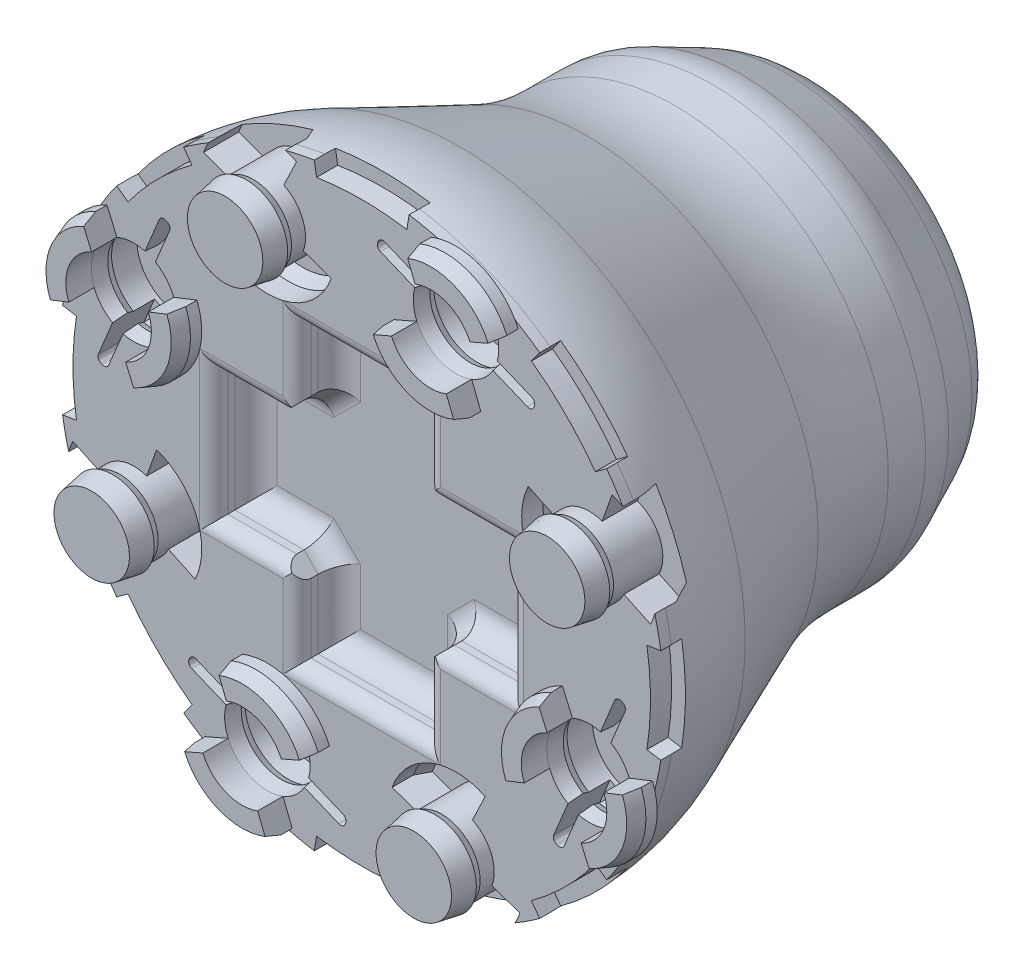
from build123d import *
from OCP.BRepFilletAPI import BRepFilletAPI_MakeChamfer
from build123d.topology import SkipClean

# Parameters (mm, degrees)
SKETCH1_R                    = 21.5
EXTRUDE1_DEPTH               = 4
CUT_EXTRUDE1_DEPTH           = 3
SKETCH3_R                    = 3.035
CUT_EXTRUDE2_DEPTH           = 1
CUT_EXTRUDE2_DRAFT           = -10
CUT_EXTRUDE2_PROFILE_2_DEPTH = 1
CUT_EXTRUDE2_PROFILE_2_DRAFT = -10
CUT_EXTRUDE2_PROFILE_3_DEPTH = 1
CUT_EXTRUDE2_PROFILE_3_DRAFT = -10
CUT_EXTRUDE2_PROFILE_4_DEPTH = 1
CUT_EXTRUDE2_PROFILE_4_DRAFT = -10
SKETCH4_R                    = 2.858673019
CUT_EXTRUDE4_DEPTH           = 0.5
CUT_EXTRUDE4_DRAFT           = 25
CUT_EXTRUDE4_PROFILE_2_DEPTH = 0.5
CUT_EXTRUDE4_PROFILE_2_DRAFT = 25
CUT_EXTRUDE4_PROFILE_3_DEPTH = 0.5
CUT_EXTRUDE4_PROFILE_3_DRAFT = 25
CUT_EXTRUDE4_PROFILE_4_DEPTH = 0.5
CUT_EXTRUDE4_PROFILE_4_DRAFT = 25
SKETCH5_R                    = 3.091826848
CUT_EXTRUDE5_DEPTH           = 1.8
SKETCH6_R                    = 2.71
EXTRUDE2_DEPTH               = 1
SKETCH7_R                    = 2.71
EXTRUDE3_DEPTH               = 0.5
EXTRUDE3_DRAFT               = -25
EXTRUDE3_PROFILE_2_DEPTH     = 0.5
EXTRUDE3_PROFILE_2_DRAFT     = -25
EXTRUDE3_PROFILE_3_DEPTH     = 0.5
EXTRUDE3_PROFILE_3_DRAFT     = -25
EXTRUDE3_PROFILE_4_DEPTH     = 0.5
EXTRUDE3_PROFILE_4_DRAFT     = -25
SKETCH8_R                    = 2.943153829
EXTRUDE4_DEPTH               = 1.5
EXTRUDE4_DRAFT               = 10
EXTRUDE4_PROFILE_2_DEPTH     = 1.5
EXTRUDE4_PROFILE_2_DRAFT     = 10
EXTRUDE4_PROFILE_3_DEPTH     = 1.5
EXTRUDE4_PROFILE_3_DRAFT     = 10
EXTRUDE4_PROFILE_4_DEPTH     = 1.5
EXTRUDE4_PROFILE_4_DRAFT     = 10
CUT_EXTRUDE6_DEPTH           = 3
EXTRUDE6_DEPTH               = 1.8
FILLET3_R                    = 1.5
CUT_EXTRUDE8_START           = -2.5
CUT_EXTRUDE8_DEPTH           = 2.5
CHAMFER2_SIZE                = 1
CHAMFER2_SIZE2               = 0.363970234
CUT_EXTRUDE9_START           = -1.5
CUT_EXTRUDE9_DEPTH           = 1.5
FILLET5_R                    = 1
SKETCH16_R                   = 21.5
EXTRUDE7_DEPTH               = 15
EXTRUDE7_TAPER               = 23
SKETCH17_R                   = 15.132877757
EXTRUDE8_DEPTH               = 14
SKETCH18_R                   = 6.35
CUT_EXTRUDE10_DEPTH          = 25.4
CHAMFER3_SIZE                = 7
CHAMFER3_SIZE2               = 3.264153607
FILLET9_R                    = 5
CUT_EXTRUDE11_DEPTH          = 44.763191002


with BuildPart() as part:
    # Sketch1 → Extrude1 (new body)
    with BuildSketch(Plane.XY):
        Circle(SKETCH1_R)
    extrude(amount=EXTRUDE1_DEPTH)

    # Sketch2 → Cut-Extrude1 (cut)
    with BuildSketch(Plane.XY.offset(4)):
        Polygon((4.6, 5.6), (4.6, 10.5), (-4.6, 10.5), (-4.6, 5.6), (-5.6, 4.6), (-10.5, 4.6), (-10.5, -4.6), (-5.6, -4.6), (-4.6, -5.6), (-4.6, -10.5), (4.6, -10.5), (4.6, -5.6), (5.6, -4.6), (10.5, -4.6), (10.5, 4.6), (5.6, 4.6), align=None)
    extrude(amount=-CUT_EXTRUDE1_DEPTH, mode=Mode.SUBTRACT)


with BuildPart() as cut_extrude2_tool:
    # Sketch3 → Cut-Extrude2 (with draft: the straight prism first)
    with BuildSketch(Plane.XY.offset(4)):
        with Locations((6.696960066, 16.167891819)):
            Circle(SKETCH3_R)
    extrude(amount=-CUT_EXTRUDE2_DEPTH)
    # Cut-Extrude2: the draft: its side faces are tilted about the plane it starts from
    cut_extrude2_sides = [cut_extrude2_tool.faces().sort_by_distance(p)[0] for p in [
        (3.661960066, 16.167891819, 3.5),
    ]]
    draft(cut_extrude2_sides, Plane.XY.offset(4), CUT_EXTRUDE2_DRAFT)


with BuildPart() as part_1:
    add(part.part)

    # Cut-Extrude2: cut by cut_extrude2_tool
    add(cut_extrude2_tool.part, mode=Mode.SUBTRACT)


with BuildPart() as cut_extrude2_profile_2_tool:
    # Sketch3 → Cut-Extrude2 profile 2 (with draft: the straight prism first)
    with BuildSketch(Plane.XY.offset(4)):
        with Locations((16.167891819, -6.696960066)):
            Circle(SKETCH3_R)
    extrude(amount=-CUT_EXTRUDE2_PROFILE_2_DEPTH)
    # Cut-Extrude2 profile 2: the draft: its side faces are tilted about the plane it starts from
    cut_extrude2_profile_2_sides = [cut_extrude2_profile_2_tool.faces().sort_by_distance(p)[0] for p in [
        (13.132891819, -6.696960066, 3.5),
    ]]
    draft(cut_extrude2_profile_2_sides, Plane.XY.offset(4), CUT_EXTRUDE2_PROFILE_2_DRAFT)


with BuildPart() as part_2:
    add(part_1.part)

    # Cut-Extrude2 profile 2: cut by cut_extrude2_profile_2_tool
    add(cut_extrude2_profile_2_tool.part, mode=Mode.SUBTRACT)


with BuildPart() as cut_extrude2_profile_3_tool:
    # Sketch3 → Cut-Extrude2 profile 3 (with draft: the straight prism first)
    with BuildSketch(Plane.XY.offset(4)):
        with Locations((-6.696960066, -16.167891819)):
            Circle(SKETCH3_R)
    extrude(amount=-CUT_EXTRUDE2_PROFILE_3_DEPTH)
    # Cut-Extrude2 profile 3: the draft: its side faces are tilted about the plane it starts from
    cut_extrude2_profile_3_sides = [cut_extrude2_profile_3_tool.faces().sort_by_distance(p)[0] for p in [
        (-9.731960066, -16.167891819, 3.5),
    ]]
    draft(cut_extrude2_profile_3_sides, Plane.XY.offset(4), CUT_EXTRUDE2_PROFILE_3_DRAFT)


with BuildPart() as part_3:
    add(part_2.part)

    # Cut-Extrude2 profile 3: cut by cut_extrude2_profile_3_tool
    add(cut_extrude2_profile_3_tool.part, mode=Mode.SUBTRACT)


with BuildPart() as cut_extrude2_profile_4_tool:
    # Sketch3 → Cut-Extrude2 profile 4 (with draft: the straight prism first)
    with BuildSketch(Plane.XY.offset(4)):
        with Locations((-16.167891819, 6.696960066)):
            Circle(SKETCH3_R)
    extrude(amount=-CUT_EXTRUDE2_PROFILE_4_DEPTH)
    # Cut-Extrude2 profile 4: the draft: its side faces are tilted about the plane it starts from
    cut_extrude2_profile_4_sides = [cut_extrude2_profile_4_tool.faces().sort_by_distance(p)[0] for p in [
        (-19.202891819, 6.696960066, 3.5),
    ]]
    draft(cut_extrude2_profile_4_sides, Plane.XY.offset(4), CUT_EXTRUDE2_PROFILE_4_DRAFT)


with BuildPart() as part_4:
    add(part_3.part)

    # Cut-Extrude2 profile 4: cut by cut_extrude2_profile_4_tool
    add(cut_extrude2_profile_4_tool.part, mode=Mode.SUBTRACT)


with BuildPart() as cut_extrude4_tool:
    # Sketch4 → Cut-Extrude4 (with draft: the straight prism first)
    with BuildSketch(Plane.XY.offset(3)):
        with Locations((-16.167891819, 6.696960066)):
            Circle(SKETCH4_R)
    extrude(amount=-CUT_EXTRUDE4_DEPTH)
    # Cut-Extrude4: the draft: its side faces are tilted about the plane it starts from
    cut_extrude4_sides = [cut_extrude4_tool.faces().sort_by_distance(p)[0] for p in [
        (-19.026564838, 6.696960066, 2.75),
    ]]
    draft(cut_extrude4_sides, Plane.XY.offset(3), CUT_EXTRUDE4_DRAFT)


with BuildPart() as part_5:
    add(part_4.part)

    # Cut-Extrude4: cut by cut_extrude4_tool
    add(cut_extrude4_tool.part, mode=Mode.SUBTRACT)


with BuildPart() as cut_extrude4_profile_2_tool:
    # Sketch4 → Cut-Extrude4 profile 2 (with draft: the straight prism first)
    with BuildSketch(Plane.XY.offset(3)):
        with Locations((6.696960066, 16.167891819)):
            Circle(SKETCH4_R)
    extrude(amount=-CUT_EXTRUDE4_PROFILE_2_DEPTH)
    # Cut-Extrude4 profile 2: the draft: its side faces are tilted about the plane it starts from
    cut_extrude4_profile_2_sides = [cut_extrude4_profile_2_tool.faces().sort_by_distance(p)[0] for p in [
        (3.838287047, 16.167891819, 2.75),
    ]]
    draft(cut_extrude4_profile_2_sides, Plane.XY.offset(3), CUT_EXTRUDE4_PROFILE_2_DRAFT)


with BuildPart() as part_6:
    add(part_5.part)

    # Cut-Extrude4 profile 2: cut by cut_extrude4_profile_2_tool
    add(cut_extrude4_profile_2_tool.part, mode=Mode.SUBTRACT)


with BuildPart() as cut_extrude4_profile_3_tool:
    # Sketch4 → Cut-Extrude4 profile 3 (with draft: the straight prism first)
    with BuildSketch(Plane.XY.offset(3)):
        with Locations((16.167891819, -6.696960066)):
            Circle(SKETCH4_R)
    extrude(amount=-CUT_EXTRUDE4_PROFILE_3_DEPTH)
    # Cut-Extrude4 profile 3: the draft: its side faces are tilted about the plane it starts from
    cut_extrude4_profile_3_sides = [cut_extrude4_profile_3_tool.faces().sort_by_distance(p)[0] for p in [
        (13.3092188, -6.696960066, 2.75),
    ]]
    draft(cut_extrude4_profile_3_sides, Plane.XY.offset(3), CUT_EXTRUDE4_PROFILE_3_DRAFT)


with BuildPart() as part_7:
    add(part_6.part)

    # Cut-Extrude4 profile 3: cut by cut_extrude4_profile_3_tool
    add(cut_extrude4_profile_3_tool.part, mode=Mode.SUBTRACT)


with BuildPart() as cut_extrude4_profile_4_tool:
    # Sketch4 → Cut-Extrude4 profile 4 (with draft: the straight prism first)
    with BuildSketch(Plane.XY.offset(3)):
        with Locations((-6.696960066, -16.167891819)):
            Circle(SKETCH4_R)
    extrude(amount=-CUT_EXTRUDE4_PROFILE_4_DEPTH)
    # Cut-Extrude4 profile 4: the draft: its side faces are tilted about the plane it starts from
    cut_extrude4_profile_4_sides = [cut_extrude4_profile_4_tool.faces().sort_by_distance(p)[0] for p in [
        (-9.555633086, -16.167891819, 2.75),
    ]]
    draft(cut_extrude4_profile_4_sides, Plane.XY.offset(3), CUT_EXTRUDE4_PROFILE_4_DRAFT)


with BuildPart() as part_8:
    add(part_7.part)

    # Cut-Extrude4 profile 4: cut by cut_extrude4_profile_4_tool
    add(cut_extrude4_profile_4_tool.part, mode=Mode.SUBTRACT)

    # Sketch5 → Cut-Extrude5 (cut)
    with BuildSketch(Plane.XY.offset(2.5)):
        with Locations((-16.167891819, 6.696960066)):
            Circle(SKETCH5_R)
        with Locations((6.696960066, 16.167891819)):
            Circle(SKETCH5_R)
        with Locations((16.167891819, -6.696960066)):
            Circle(SKETCH5_R)
        with Locations((-6.696960066, -16.167891819)):
            Circle(SKETCH5_R)
    extrude(amount=-CUT_EXTRUDE5_DEPTH, mode=Mode.SUBTRACT)

    # Sketch6 → Extrude2 (add)
    with BuildSketch(Plane.XY.offset(4)):
        with Locations((-6.696960066, 16.167891819)):
            Circle(SKETCH6_R)
        with Locations((16.167891819, 6.696960066)):
            Circle(SKETCH6_R)
        with Locations((6.696960066, -16.167891819)):
            Circle(SKETCH6_R)
        with Locations((-16.167891819, -6.696960066)):
            Circle(SKETCH6_R)
    extrude(amount=EXTRUDE2_DEPTH)


with BuildPart() as extrude3_tool:
    # Sketch7 → Extrude3 (with draft: the straight prism first)
    with BuildSketch(Plane.XY.offset(5)):
        with Locations((-6.696960066, 16.167891819)):
            Circle(SKETCH7_R)
    extrude(amount=EXTRUDE3_DEPTH)
    # Extrude3: the draft: its side faces are tilted about the plane it starts from
    extrude3_sides = [extrude3_tool.faces().sort_by_distance(p)[0] for p in [
        (-9.406960066, 16.167891819, 5.25),
    ]]
    draft(extrude3_sides, Plane.XY.offset(5), EXTRUDE3_DRAFT)


with BuildPart() as part_9:
    add(part_8.part)

    # Extrude3: add extrude3_tool
    add(extrude3_tool.part)


with BuildPart() as extrude3_profile_2_tool:
    # Sketch7 → Extrude3 profile 2 (with draft: the straight prism first)
    with BuildSketch(Plane.XY.offset(5)):
        with Locations((16.167891819, 6.696960066)):
            Circle(SKETCH7_R)
    extrude(amount=EXTRUDE3_PROFILE_2_DEPTH)
    # Extrude3 profile 2: the draft: its side faces are tilted about the plane it starts from
    extrude3_profile_2_sides = [extrude3_profile_2_tool.faces().sort_by_distance(p)[0] for p in [
        (13.457891819, 6.696960066, 5.25),
    ]]
    draft(extrude3_profile_2_sides, Plane.XY.offset(5), EXTRUDE3_PROFILE_2_DRAFT)


with BuildPart() as part_10:
    add(part_9.part)

    # Extrude3 profile 2: add extrude3_profile_2_tool
    add(extrude3_profile_2_tool.part)


with BuildPart() as extrude3_profile_3_tool:
    # Sketch7 → Extrude3 profile 3 (with draft: the straight prism first)
    with BuildSketch(Plane.XY.offset(5)):
        with Locations((6.696960066, -16.167891819)):
            Circle(SKETCH7_R)
    extrude(amount=EXTRUDE3_PROFILE_3_DEPTH)
    # Extrude3 profile 3: the draft: its side faces are tilted about the plane it starts from
    extrude3_profile_3_sides = [extrude3_profile_3_tool.faces().sort_by_distance(p)[0] for p in [
        (3.986960066, -16.167891819, 5.25),
    ]]
    draft(extrude3_profile_3_sides, Plane.XY.offset(5), EXTRUDE3_PROFILE_3_DRAFT)


with BuildPart() as part_11:
    add(part_10.part)

    # Extrude3 profile 3: add extrude3_profile_3_tool
    add(extrude3_profile_3_tool.part)


with BuildPart() as extrude3_profile_4_tool:
    # Sketch7 → Extrude3 profile 4 (with draft: the straight prism first)
    with BuildSketch(Plane.XY.offset(5)):
        with Locations((-16.167891819, -6.696960066)):
            Circle(SKETCH7_R)
    extrude(amount=EXTRUDE3_PROFILE_4_DEPTH)
    # Extrude3 profile 4: the draft: its side faces are tilted about the plane it starts from
    extrude3_profile_4_sides = [extrude3_profile_4_tool.faces().sort_by_distance(p)[0] for p in [
        (-18.877891819, -6.696960066, 5.25),
    ]]
    draft(extrude3_profile_4_sides, Plane.XY.offset(5), EXTRUDE3_PROFILE_4_DRAFT)


with BuildPart() as part_12:
    add(part_11.part)

    # Extrude3 profile 4: add extrude3_profile_4_tool
    add(extrude3_profile_4_tool.part)


with BuildPart() as extrude4_tool:
    # Sketch8 → Extrude4 (with draft: the straight prism first)
    with BuildSketch(Plane.XY.offset(5.5)):
        with Locations((-6.696960066, 16.167891819)):
            Circle(SKETCH8_R)
    extrude(amount=EXTRUDE4_DEPTH)
    # Extrude4: the draft: its side faces are tilted about the plane it starts from
    extrude4_sides = [extrude4_tool.faces().sort_by_distance(p)[0] for p in [
        (-9.640113895, 16.167891819, 6.25),
    ]]
    draft(extrude4_sides, Plane.XY.offset(5.5), EXTRUDE4_DRAFT)


with BuildPart() as part_13:
    add(part_12.part)

    # Extrude4: add extrude4_tool
    add(extrude4_tool.part)


with BuildPart() as extrude4_profile_2_tool:
    # Sketch8 → Extrude4 profile 2 (with draft: the straight prism first)
    with BuildSketch(Plane.XY.offset(5.5)):
        with Locations((16.167891819, 6.696960066)):
            Circle(SKETCH8_R)
    extrude(amount=EXTRUDE4_PROFILE_2_DEPTH)
    # Extrude4 profile 2: the draft: its side faces are tilted about the plane it starts from
    extrude4_profile_2_sides = [extrude4_profile_2_tool.faces().sort_by_distance(p)[0] for p in [
        (13.22473799, 6.696960066, 6.25),
    ]]
    draft(extrude4_profile_2_sides, Plane.XY.offset(5.5), EXTRUDE4_PROFILE_2_DRAFT)


with BuildPart() as part_14:
    add(part_13.part)

    # Extrude4 profile 2: add extrude4_profile_2_tool
    add(extrude4_profile_2_tool.part)


with BuildPart() as extrude4_profile_3_tool:
    # Sketch8 → Extrude4 profile 3 (with draft: the straight prism first)
    with BuildSketch(Plane.XY.offset(5.5)):
        with Locations((6.696960066, -16.167891819)):
            Circle(SKETCH8_R)
    extrude(amount=EXTRUDE4_PROFILE_3_DEPTH)
    # Extrude4 profile 3: the draft: its side faces are tilted about the plane it starts from
    extrude4_profile_3_sides = [extrude4_profile_3_tool.faces().sort_by_distance(p)[0] for p in [
        (3.753806237, -16.167891819, 6.25),
    ]]
    draft(extrude4_profile_3_sides, Plane.XY.offset(5.5), EXTRUDE4_PROFILE_3_DRAFT)


with BuildPart() as part_15:
    add(part_14.part)

    # Extrude4 profile 3: add extrude4_profile_3_tool
    add(extrude4_profile_3_tool.part)


with BuildPart() as extrude4_profile_4_tool:
    # Sketch8 → Extrude4 profile 4 (with draft: the straight prism first)
    with BuildSketch(Plane.XY.offset(5.5)):
        with Locations((-16.167891819, -6.696960066)):
            Circle(SKETCH8_R)
    extrude(amount=EXTRUDE4_PROFILE_4_DEPTH)
    # Extrude4 profile 4: the draft: its side faces are tilted about the plane it starts from
    extrude4_profile_4_sides = [extrude4_profile_4_tool.faces().sort_by_distance(p)[0] for p in [
        (-19.111045648, -6.696960066, 6.25),
    ]]
    draft(extrude4_profile_4_sides, Plane.XY.offset(5.5), EXTRUDE4_PROFILE_4_DRAFT)


with BuildPart() as part_16:
    add(part_15.part)

    # Extrude4 profile 4: add extrude4_profile_4_tool
    add(extrude4_profile_4_tool.part)

    # Sketch9 → Cut-Extrude6 (cut)
    with BuildSketch(Plane.XY.offset(4)):
        with BuildLine():
            Line((18.699605025, -1.630114081), (14.375282239, -12.069952798))
            ThreePointArc((14.375282239, -12.069952798), (14.185863604, -12.259371433), (13.917985201, -12.259371433))
            Line((13.917985201, -12.259371433), (13.825597248, -12.22110309))
            ThreePointArc((13.825597248, -12.22110309), (13.636178613, -12.031684455), (13.636178613, -11.763806052))
            Line((13.636178613, -11.763806052), (17.960501399, -1.323967335))
            ThreePointArc((17.960501399, -1.323967335), (18.149920034, -1.1345487), (18.417798437, -1.1345487))
            Line((18.417798437, -1.1345487), (18.51018639, -1.172817043))
            ThreePointArc((18.51018639, -1.172817043), (18.699605025, -1.362235678), (18.699605025, -1.630114081))
        make_face()
        with BuildLine():
            Line((-1.630114081, -18.699605025), (-12.069952798, -14.375282239))
            ThreePointArc((-12.069952798, -14.375282239), (-12.259371433, -14.185863604), (-12.259371433, -13.917985201))
            Line((-12.259371433, -13.917985201), (-12.22110309, -13.825597248))
            ThreePointArc((-12.22110309, -13.825597248), (-12.031684455, -13.636178613), (-11.763806052, -13.636178613))
            Line((-11.763806052, -13.636178613), (-1.323967335, -17.960501399))
            ThreePointArc((-1.323967335, -17.960501399), (-1.1345487, -18.149920034), (-1.1345487, -18.417798437))
            Line((-1.1345487, -18.417798437), (-1.172817043, -18.51018639))
            ThreePointArc((-1.172817043, -18.51018639), (-1.362235678, -18.699605025), (-1.630114081, -18.699605025))
        make_face()
        with BuildLine():
            Line((-18.699605025, 1.630114081), (-14.375282239, 12.069952798))
            ThreePointArc((-14.375282239, 12.069952798), (-14.185863604, 12.259371433), (-13.917985201, 12.259371433))
            Line((-13.917985201, 12.259371433), (-13.825597248, 12.22110309))
            ThreePointArc((-13.825597248, 12.22110309), (-13.636178613, 12.031684455), (-13.636178613, 11.763806052))
            Line((-13.636178613, 11.763806052), (-17.960501399, 1.323967335))
            ThreePointArc((-17.960501399, 1.323967335), (-18.149920034, 1.1345487), (-18.417798437, 1.1345487))
            Line((-18.417798437, 1.1345487), (-18.51018639, 1.172817043))
            ThreePointArc((-18.51018639, 1.172817043), (-18.699605025, 1.362235678), (-18.699605025, 1.630114081))
        make_face()
        with BuildLine():
            Line((1.630114081, 18.699605025), (12.069952798, 14.375282239))
            ThreePointArc((12.069952798, 14.375282239), (12.259371433, 14.185863604), (12.259371433, 13.917985201))
            Line((12.259371433, 13.917985201), (12.22110309, 13.825597248))
            ThreePointArc((12.22110309, 13.825597248), (12.031684455, 13.636178613), (11.763806052, 13.636178613))
            Line((11.763806052, 13.636178613), (1.323967335, 17.960501399))
            ThreePointArc((1.323967335, 17.960501399), (1.1345487, 18.149920034), (1.1345487, 18.417798437))
            Line((1.1345487, 18.417798437), (1.172817043, 18.51018639))
            ThreePointArc((1.172817043, 18.51018639), (1.362235678, 18.699605025), (1.630114081, 18.699605025))
        make_face()
    extrude(amount=-CUT_EXTRUDE6_DEPTH, mode=Mode.SUBTRACT)

    # Sketch13 → Extrude6 (add)
    with BuildSketch(Plane.XY.offset(4)):
        with BuildLine():
            Line((17.378095243, -9.480237392), (18.08587484, -11.108019024))
            ThreePointArc((18.08587484, -11.108019024), (20.61175237, -8.537667376), (20.643200321, -4.934089166))
            Line((20.643200321, -4.934089166), (18.991709138, -5.584628843))
            ThreePointArc((18.991709138, -5.584628843), (18.9718662, -7.858404284), (17.378095243, -9.480237392))
        make_face()
        with BuildLine():
            Line((14.957688395, -3.913682741), (14.249908797, -2.285901109))
            ThreePointArc((14.249908797, -2.285901109), (11.724031268, -4.856252757), (11.692583317, -8.459830967))
            Line((11.692583317, -8.459830967), (13.3440745, -7.809291289))
            ThreePointArc((13.3440745, -7.809291289), (13.363917438, -5.535515849), (14.957688395, -3.913682741))
        make_face()
        with BuildLine():
            Line((-9.480237392, -17.378095243), (-11.108019024, -18.08587484))
            ThreePointArc((-11.108019024, -18.08587484), (-8.537667376, -20.61175237), (-4.934089166, -20.643200321))
            Line((-4.934089166, -20.643200321), (-5.584628843, -18.991709138))
            ThreePointArc((-5.584628843, -18.991709138), (-7.858404284, -18.9718662), (-9.480237392, -17.378095243))
        make_face()
        with BuildLine():
            Line((-3.913682741, -14.957688395), (-2.285901109, -14.249908797))
            ThreePointArc((-2.285901109, -14.249908797), (-4.856252757, -11.724031268), (-8.459830967, -11.692583317))
            Line((-8.459830967, -11.692583317), (-7.809291289, -13.3440745))
            ThreePointArc((-7.809291289, -13.3440745), (-5.535515849, -13.363917438), (-3.913682741, -14.957688395))
        make_face()
        with BuildLine():
            Line((-17.378095243, 9.480237392), (-18.08587484, 11.108019024))
            ThreePointArc((-18.08587484, 11.108019024), (-20.61175237, 8.537667376), (-20.643200321, 4.934089166))
            Line((-20.643200321, 4.934089166), (-18.991709138, 5.584628843))
            ThreePointArc((-18.991709138, 5.584628843), (-18.9718662, 7.858404284), (-17.378095243, 9.480237392))
        make_face()
        with BuildLine():
            Line((-14.957688395, 3.913682741), (-14.249908797, 2.285901109))
            ThreePointArc((-14.249908797, 2.285901109), (-11.724031268, 4.856252757), (-11.692583317, 8.459830967))
            Line((-11.692583317, 8.459830967), (-13.3440745, 7.809291289))
            ThreePointArc((-13.3440745, 7.809291289), (-13.363917438, 5.535515849), (-14.957688395, 3.913682741))
        make_face()
        with BuildLine():
            Line((9.480237392, 17.378095243), (11.108019024, 18.08587484))
            ThreePointArc((11.108019024, 18.08587484), (8.537667376, 20.61175237), (4.934089166, 20.643200321))
            Line((4.934089166, 20.643200321), (5.584628843, 18.991709138))
            ThreePointArc((5.584628843, 18.991709138), (7.858404284, 18.9718662), (9.480237392, 17.378095243))
        make_face()
        with BuildLine():
            Line((3.913682741, 14.957688395), (2.285901109, 14.249908797))
            ThreePointArc((2.285901109, 14.249908797), (4.856252757, 11.724031268), (8.459830967, 11.692583317))
            Line((8.459830967, 11.692583317), (7.809291289, 13.3440745))
            ThreePointArc((7.809291289, 13.3440745), (5.535515849, 13.363917438), (3.913682741, 14.957688395))
        make_face()
    extrude(amount=EXTRUDE6_DEPTH)

    # Fillet3
    fillet3_edges = [part_16.edges().sort_by_distance(p)[0] for p in [
        (-4.6, 8.05, 1),
        (0, 10.5, 1),
        (4.6, 8.05, 1),
        (5.1, 5.1, 1),
        (8.05, 4.6, 1),
        (10.5, 0, 1),
        (8.05, -4.6, 1),
        (5.1, -5.1, 1),
        (4.6, -8.05, 1),
        (0, -10.5, 1),
        (-4.6, -8.05, 1),
        (-5.1, -5.1, 1),
        (-8.05, -4.6, 1),
        (-10.5, 0, 1),
        (-8.05, 4.6, 1),
        (-5.1, 5.1, 1),
    ]]
    fillet(fillet3_edges, radius=FILLET3_R)

    # Sketch14 → Cut-Extrude8 (cut)
    with SkipClean():  # the faces are left unmerged after this step: merging them gives an invalid solid
        with BuildSketch(Plane.XY.offset(4).offset(CUT_EXTRUDE8_START)):
            with BuildLine():
                Line((-18.61389794, -5.530274994), (-20.509327037, -4.626201691))
                ThreePointArc((-20.509327037, -4.626201691), (-20.61175237, -8.537667376), (-17.773502812, -11.231065639))
                Line((-17.773502812, -11.231065639), (-17.072508407, -9.251518507))
                ThreePointArc((-17.072508407, -9.251518507), (-18.671605352, -7.734032168), (-18.61389794, -5.530274994))
            make_face()
            with BuildLine():
                Line((-13.721885698, -7.863645139), (-11.826456601, -8.767718442))
                ThreePointArc((-11.826456601, -8.767718442), (-11.724031268, -4.856252757), (-14.562280826, -2.162854494))
                Line((-14.562280826, -2.162854494), (-15.26327523, -4.142401626))
                ThreePointArc((-15.26327523, -4.142401626), (-13.664178286, -5.659887965), (-13.721885698, -7.863645139))
            make_face()
            with BuildLine():
                Line((-5.530274994, 18.61389794), (-4.626201691, 20.509327037))
                ThreePointArc((-4.626201691, 20.509327037), (-8.537667376, 20.61175237), (-11.231065639, 17.773502812))
                Line((-11.231065639, 17.773502812), (-9.251518507, 17.072508407))
                ThreePointArc((-9.251518507, 17.072508407), (-7.734032168, 18.671605352), (-5.530274994, 18.61389794))
            make_face()
            with BuildLine():
                Line((-7.863645139, 13.721885698), (-8.767718442, 11.826456601))
                ThreePointArc((-8.767718442, 11.826456601), (-4.856252757, 11.724031268), (-2.162854494, 14.562280826))
                Line((-2.162854494, 14.562280826), (-4.142401626, 15.26327523))
                ThreePointArc((-4.142401626, 15.26327523), (-5.659887965, 13.664178286), (-7.863645139, 13.721885698))
            make_face()
            with BuildLine():
                Line((18.61389794, 5.530274994), (20.509327037, 4.626201691))
                ThreePointArc((20.509327037, 4.626201691), (20.61175237, 8.537667376), (17.773502812, 11.231065639))
                Line((17.773502812, 11.231065639), (17.072508407, 9.251518507))
                ThreePointArc((17.072508407, 9.251518507), (18.671605352, 7.734032168), (18.61389794, 5.530274994))
            make_face()
            with BuildLine():
                Line((13.721885698, 7.863645139), (11.826456601, 8.767718442))
                ThreePointArc((11.826456601, 8.767718442), (11.724031268, 4.856252757), (14.562280826, 2.162854494))
                Line((14.562280826, 2.162854494), (15.26327523, 4.142401626))
                ThreePointArc((15.26327523, 4.142401626), (13.664178286, 5.659887965), (13.721885698, 7.863645139))
            make_face()
            with BuildLine():
                Line((5.530274994, -18.61389794), (4.626201691, -20.509327037))
                ThreePointArc((4.626201691, -20.509327037), (8.537667376, -20.61175237), (11.231065639, -17.773502812))
                Line((11.231065639, -17.773502812), (9.251518507, -17.072508407))
                ThreePointArc((9.251518507, -17.072508407), (7.734032168, -18.671605352), (5.530274994, -18.61389794))
            make_face()
            with BuildLine():
                Line((7.863645139, -13.721885698), (8.767718442, -11.826456601))
                ThreePointArc((8.767718442, -11.826456601), (4.856252757, -11.724031268), (2.162854494, -14.562280826))
                Line((2.162854494, -14.562280826), (4.142401626, -15.26327523))
                ThreePointArc((4.142401626, -15.26327523), (5.659887965, -13.664178286), (7.863645139, -13.721885698))
            make_face()
        extrude(amount=CUT_EXTRUDE8_DEPTH, mode=Mode.SUBTRACT)

    # Chamfer2: one chamfer whose edges measure the first distance from different faces: ONE call of the kernel's chamfer builder (chamfer() names one face for all edges)
    chamfer2_edges_1 = [part_16.edges().sort_by_distance(p)[0] for p in [
        (11.724031268, -4.856252757, 5.8),
    ]]
    chamfer2_side_1 = [part_16.faces().sort_by_distance(p)[0] for p in [
        (11.724031268, -4.856252757, 4.9),
    ]]
    chamfer2_edges_2 = [part_16.edges().sort_by_distance(p)[0] for p in [
        (20.61175237, -8.537667376, 5.8),
    ]]
    chamfer2_side_2 = [part_16.faces().sort_by_distance(p)[0] for p in [
        (20.61175237, -8.537667376, 4.9),
    ]]
    chamfer2_edges_3 = [part_16.edges().sort_by_distance(p)[0] for p in [
        (-4.856252757, -11.724031268, 5.8),
    ]]
    chamfer2_side_3 = [part_16.faces().sort_by_distance(p)[0] for p in [
        (-4.856252757, -11.724031268, 4.9),
    ]]
    chamfer2_edges_4 = [part_16.edges().sort_by_distance(p)[0] for p in [
        (-8.537667376, -20.61175237, 5.8),
    ]]
    chamfer2_side_4 = [part_16.faces().sort_by_distance(p)[0] for p in [
        (-8.537667376, -20.61175237, 4.9),
    ]]
    chamfer2_edges_5 = [part_16.edges().sort_by_distance(p)[0] for p in [
        (-11.724031268, 4.856252757, 5.8),
    ]]
    chamfer2_side_5 = [part_16.faces().sort_by_distance(p)[0] for p in [
        (-11.724031268, 4.856252757, 4.9),
    ]]
    chamfer2_edges_6 = [part_16.edges().sort_by_distance(p)[0] for p in [
        (-20.61175237, 8.537667376, 5.8),
    ]]
    chamfer2_side_6 = [part_16.faces().sort_by_distance(p)[0] for p in [
        (-20.61175237, 8.537667376, 4.9),
    ]]
    chamfer2_edges_7 = [part_16.edges().sort_by_distance(p)[0] for p in [
        (4.856252757, 11.724031268, 5.8),
    ]]
    chamfer2_side_7 = [part_16.faces().sort_by_distance(p)[0] for p in [
        (4.856252757, 11.724031268, 4.9),
    ]]
    chamfer2_edges_8 = [part_16.edges().sort_by_distance(p)[0] for p in [
        (8.537667376, 20.61175237, 5.8),
    ]]
    chamfer2_side_8 = [part_16.faces().sort_by_distance(p)[0] for p in [
        (8.537667376, 20.61175237, 4.9),
    ]]
    chamfer2_edges_9 = [part_16.edges().sort_by_distance(p)[0] for p in [
        (-20.674928795, -5.016865517, 1.5),
    ]]
    chamfer2_side_9 = [part_16.faces().sort_by_distance(p)[0] for p in [
        (-20.674928795, -5.016865517, 2.75),
    ]]
    chamfer2_edges_10 = [part_16.edges().sort_by_distance(p)[0] for p in [
        (-11.724031268, -4.856252757, 1.5),
    ]]
    chamfer2_side_10 = [part_16.faces().sort_by_distance(p)[0] for p in [
        (-11.724031268, -4.856252757, 2.75),
    ]]
    chamfer2_edges_11 = [part_16.edges().sort_by_distance(p)[0] for p in [
        (-5.016865517, 20.674928795, 1.5),
    ]]
    chamfer2_side_11 = [part_16.faces().sort_by_distance(p)[0] for p in [
        (-5.016865517, 20.674928795, 2.75),
    ]]
    chamfer2_edges_12 = [part_16.edges().sort_by_distance(p)[0] for p in [
        (-4.856252757, 11.724031268, 1.5),
    ]]
    chamfer2_side_12 = [part_16.faces().sort_by_distance(p)[0] for p in [
        (-4.856252757, 11.724031268, 2.75),
    ]]
    chamfer2_edges_13 = [part_16.edges().sort_by_distance(p)[0] for p in [
        (20.674928795, 5.016865517, 1.5),
    ]]
    chamfer2_side_13 = [part_16.faces().sort_by_distance(p)[0] for p in [
        (20.674928795, 5.016865517, 2.75),
    ]]
    chamfer2_edges_14 = [part_16.edges().sort_by_distance(p)[0] for p in [
        (11.724031268, 4.856252757, 1.5),
    ]]
    chamfer2_side_14 = [part_16.faces().sort_by_distance(p)[0] for p in [
        (11.724031268, 4.856252757, 2.75),
    ]]
    chamfer2_edges_15 = [part_16.edges().sort_by_distance(p)[0] for p in [
        (5.016865517, -20.674928795, 1.5),
    ]]
    chamfer2_side_15 = [part_16.faces().sort_by_distance(p)[0] for p in [
        (5.016865517, -20.674928795, 2.75),
    ]]
    chamfer2_edges_16 = [part_16.edges().sort_by_distance(p)[0] for p in [
        (4.856252757, -11.724031268, 1.5),
    ]]
    chamfer2_side_16 = [part_16.faces().sort_by_distance(p)[0] for p in [
        (4.856252757, -11.724031268, 2.75),
    ]]
    chamfer2 = BRepFilletAPI_MakeChamfer(part_16.part.solid().wrapped)
    for e in chamfer2_edges_1:
        chamfer2.Add(CHAMFER2_SIZE, CHAMFER2_SIZE2, e.wrapped, chamfer2_side_1[0].wrapped)  # the first distance lies on this face
    for e in chamfer2_edges_2:
        chamfer2.Add(CHAMFER2_SIZE, CHAMFER2_SIZE2, e.wrapped, chamfer2_side_2[0].wrapped)  # the first distance lies on this face
    for e in chamfer2_edges_3:
        chamfer2.Add(CHAMFER2_SIZE, CHAMFER2_SIZE2, e.wrapped, chamfer2_side_3[0].wrapped)  # the first distance lies on this face
    for e in chamfer2_edges_4:
        chamfer2.Add(CHAMFER2_SIZE, CHAMFER2_SIZE2, e.wrapped, chamfer2_side_4[0].wrapped)  # the first distance lies on this face
    for e in chamfer2_edges_5:
        chamfer2.Add(CHAMFER2_SIZE, CHAMFER2_SIZE2, e.wrapped, chamfer2_side_5[0].wrapped)  # the first distance lies on this face
    for e in chamfer2_edges_6:
        chamfer2.Add(CHAMFER2_SIZE, CHAMFER2_SIZE2, e.wrapped, chamfer2_side_6[0].wrapped)  # the first distance lies on this face
    for e in chamfer2_edges_7:
        chamfer2.Add(CHAMFER2_SIZE, CHAMFER2_SIZE2, e.wrapped, chamfer2_side_7[0].wrapped)  # the first distance lies on this face
    for e in chamfer2_edges_8:
        chamfer2.Add(CHAMFER2_SIZE, CHAMFER2_SIZE2, e.wrapped, chamfer2_side_8[0].wrapped)  # the first distance lies on this face
    for e in chamfer2_edges_9:
        chamfer2.Add(CHAMFER2_SIZE, CHAMFER2_SIZE2, e.wrapped, chamfer2_side_9[0].wrapped)  # the first distance lies on this face
    for e in chamfer2_edges_10:
        chamfer2.Add(CHAMFER2_SIZE, CHAMFER2_SIZE2, e.wrapped, chamfer2_side_10[0].wrapped)  # the first distance lies on this face
    for e in chamfer2_edges_11:
        chamfer2.Add(CHAMFER2_SIZE, CHAMFER2_SIZE2, e.wrapped, chamfer2_side_11[0].wrapped)  # the first distance lies on this face
    for e in chamfer2_edges_12:
        chamfer2.Add(CHAMFER2_SIZE, CHAMFER2_SIZE2, e.wrapped, chamfer2_side_12[0].wrapped)  # the first distance lies on this face
    for e in chamfer2_edges_13:
        chamfer2.Add(CHAMFER2_SIZE, CHAMFER2_SIZE2, e.wrapped, chamfer2_side_13[0].wrapped)  # the first distance lies on this face
    for e in chamfer2_edges_14:
        chamfer2.Add(CHAMFER2_SIZE, CHAMFER2_SIZE2, e.wrapped, chamfer2_side_14[0].wrapped)  # the first distance lies on this face
    for e in chamfer2_edges_15:
        chamfer2.Add(CHAMFER2_SIZE, CHAMFER2_SIZE2, e.wrapped, chamfer2_side_15[0].wrapped)  # the first distance lies on this face
    for e in chamfer2_edges_16:
        chamfer2.Add(CHAMFER2_SIZE, CHAMFER2_SIZE2, e.wrapped, chamfer2_side_16[0].wrapped)  # the first distance lies on this face
    add(Compound.cast(chamfer2.Shape()), mode=Mode.REPLACE)

    # Sketch15 → Cut-Extrude9 (cut)
    with SkipClean():  # the faces are left unmerged after this step: merging them gives an invalid solid
        with BuildSketch(Plane.XY.offset(4).offset(CUT_EXTRUDE9_START)):
            with BuildLine():
                Line((3.363340998, -21.235299323), (3.206906533, -20.247610982))
                ThreePointArc((3.206906533, -20.247610982), (0, -20.5), (-3.206906533, -20.247610982))
                Line((-3.206906533, -20.247610982), (-3.363340998, -21.235299323))
                ThreePointArc((-3.363340998, -21.235299323), (0, -21.5), (3.363340998, -21.235299323))
            make_face()
            with BuildLine():
                Line((-12.637382924, -17.393865379), (-12.049597672, -16.584848385))
                ThreePointArc((-12.049597672, -16.584848385), (-14.495689014, -14.495689014), (-16.584848385, -12.049597672))
                Line((-16.584848385, -12.049597672), (-17.393865379, -12.637382924))
                ThreePointArc((-17.393865379, -12.637382924), (-15.202795796, -15.202795796), (-12.637382924, -17.393865379))
            make_face()
            with BuildLine():
                Line((-21.235299323, -3.363340998), (-20.247610982, -3.206906533))
                ThreePointArc((-20.247610982, -3.206906533), (-20.5, 0), (-20.247610982, 3.206906533))
                Line((-20.247610982, 3.206906533), (-21.235299323, 3.363340998))
                ThreePointArc((-21.235299323, 3.363340998), (-21.5, 0), (-21.235299323, -3.363340998))
            make_face()
            with BuildLine():
                Line((-17.393865379, 12.637382924), (-16.584848385, 12.049597672))
                ThreePointArc((-16.584848385, 12.049597672), (-14.495689014, 14.495689014), (-12.049597672, 16.584848385))
                Line((-12.049597672, 16.584848385), (-12.637382924, 17.393865379))
                ThreePointArc((-12.637382924, 17.393865379), (-15.202795796, 15.202795796), (-17.393865379, 12.637382924))
            make_face()
            with BuildLine():
                Line((-3.363340998, 21.235299323), (-3.206906533, 20.247610982))
                ThreePointArc((-3.206906533, 20.247610982), (0, 20.5), (3.206906533, 20.247610982))
                Line((3.206906533, 20.247610982), (3.363340998, 21.235299323))
                ThreePointArc((3.363340998, 21.235299323), (0, 21.5), (-3.363340998, 21.235299323))
            make_face()
            with BuildLine():
                Line((12.637382924, 17.393865379), (12.049597672, 16.584848385))
                ThreePointArc((12.049597672, 16.584848385), (14.495689014, 14.495689014), (16.584848385, 12.049597672))
                Line((16.584848385, 12.049597672), (17.393865379, 12.637382924))
                ThreePointArc((17.393865379, 12.637382924), (15.202795796, 15.202795796), (12.637382924, 17.393865379))
            make_face()
            with BuildLine():
                Line((21.235299323, 3.363340998), (20.247610982, 3.206906533))
                ThreePointArc((20.247610982, 3.206906533), (20.5, 0), (20.247610982, -3.206906533))
                Line((20.247610982, -3.206906533), (21.235299323, -3.363340998))
                ThreePointArc((21.235299323, -3.363340998), (21.5, 0), (21.235299323, 3.363340998))
            make_face()
            with BuildLine():
                Line((17.393865379, -12.637382924), (16.584848385, -12.049597672))
                ThreePointArc((16.584848385, -12.049597672), (14.495689014, -14.495689014), (12.049597672, -16.584848385))
                Line((12.049597672, -16.584848385), (12.637382924, -17.393865379))
                ThreePointArc((12.637382924, -17.393865379), (15.202795796, -15.202795796), (17.393865379, -12.637382924))
            make_face()
        extrude(amount=CUT_EXTRUDE9_DEPTH, mode=Mode.SUBTRACT)

    # Fillet5
    # the kernel refuses this fillet: 1 mm, written as the material it takes off along each edge
    with BuildSketch(Plane(origin=(3.1, -4.6, 4), x_dir=(0, -1, 0), z_dir=(1, 0, 0)), Plane(origin=(4.6, -10.5, 4), x_dir=(1, 0, 0), z_dir=(0, 1, 0)), Plane(origin=(-10.5, -4.6, 4), x_dir=(0, -1, 0), z_dir=(1, 0, 0)), Plane(origin=(-3.1, 4.6, 4), x_dir=(0, 1, 0), z_dir=(-1, 0, 0)), Plane(origin=(-4.6, 10.5, 4), x_dir=(-1, 0, 0), z_dir=(0, -1, 0)), Plane(origin=(4.6, 3.1, 4), x_dir=(1, 0, 0), z_dir=(0, 1, 0)), Plane(origin=(10.5, 4.6, 4), x_dir=(0, 1, 0), z_dir=(-1, 0, 0)), Plane(origin=(-4.6, -3.1, 4), x_dir=(-1, 0, 0), z_dir=(0, -1, 0))) as fillet5_piece_1:
        with BuildLine():
            CenterArc((FILLET5_R, FILLET5_R), FILLET5_R, 180, 90)
            Line((0, FILLET5_R), (0, 0))
            Line((0, 0), (FILLET5_R, 0))
        make_face()
    extrude(amount=7.4, mode=Mode.SUBTRACT)
    with BuildSketch(Plane(origin=(-4.6, -10.5, 4), x_dir=(0, -1, 0), z_dir=(1, 0, 0)), Plane(origin=(-10.5, 4.6, 4), x_dir=(-1, 0, 0), z_dir=(0, -1, 0)), Plane(origin=(4.6, 10.5, 4), x_dir=(0, 1, 0), z_dir=(-1, 0, 0)), Plane(origin=(10.5, -4.6, 4), x_dir=(1, 0, 0), z_dir=(0, 1, 0))) as fillet5_piece_2:
        with BuildLine():
            CenterArc((FILLET5_R, FILLET5_R), FILLET5_R, 180, 90)
            Line((0, FILLET5_R), (0, 0))
            Line((0, 0), (FILLET5_R, 0))
        make_face()
    extrude(amount=9.2, mode=Mode.SUBTRACT)
    with BuildSketch(Plane(origin=(10.5, -7.1, 4), x_dir=(1, 0, 0), z_dir=(0, 1, 0))) as fillet5_piece_3a_section:
        with BuildLine():
            CenterArc((FILLET5_R, FILLET5_R), FILLET5_R, 180, 90)
            Line((0, FILLET5_R), (0, 0))
            Line((0, 0), (FILLET5_R, 0))
        make_face()
    fillet5_piece_3a = extrude(amount=11.7, mode=Mode.PRIVATE)
    fillet5_piece_3a = fillet5_piece_3a - Plane(origin=(16.167891819, -6.696960066, 4), x_dir=(-0.39874906892521667, 0.9170600743851369, 0), z_dir=(0, 0, -1)) * Cylinder(4.81, 28, mode=Mode.PRIVATE)
    fillet5_piece_3a = split(fillet5_piece_3a, bisect_by=Plane(origin=(10.5, -4.6, 4), z_dir=(0, -1, 0)), keep=Keep.TOP, mode=Mode.PRIVATE)
    with BuildSketch(Plane(origin=(3.1, -4.6, 4), x_dir=(0, -1, 0), z_dir=(1, 0, 0))) as fillet5_piece_3b_section:
        with BuildLine():
            CenterArc((FILLET5_R, FILLET5_R), FILLET5_R, 180, 90)
            Line((0, FILLET5_R), (0, 0))
            Line((0, 0), (FILLET5_R, 0))
        make_face()
    fillet5_piece_3b = extrude(amount=9.9, mode=Mode.PRIVATE)
    fillet5_piece_3b = fillet5_piece_3b - Plane(origin=(16.167891819, -6.696960066, 4), x_dir=(-0.39874906892521667, 0.9170600743851369, 0), z_dir=(0, 0, -1)) * Cylinder(4.81, 24, mode=Mode.PRIVATE)
    fillet5_piece_3b = split(fillet5_piece_3b, bisect_by=Plane(origin=(10.5, -4.6, 4), z_dir=(1, 0, 0)), keep=Keep.TOP, mode=Mode.PRIVATE)
    fillet5_piece_3 = fillet5_piece_3a & fillet5_piece_3b
    add(fillet5_piece_3, mode=Mode.SUBTRACT)
    with BuildSketch(Plane(origin=(4.6, -13, 4), x_dir=(1, 0, 0), z_dir=(0, 1, 0))) as fillet5_piece_4a_section:
        with BuildLine():
            CenterArc((FILLET5_R, FILLET5_R), FILLET5_R, 180, 90)
            Line((0, FILLET5_R), (0, 0))
            Line((0, 0), (FILLET5_R, 0))
        make_face()
    fillet5_piece_4a = extrude(amount=9.9, mode=Mode.PRIVATE)
    fillet5_piece_4a = split(fillet5_piece_4a, bisect_by=Plane(origin=(4.6, -10.5, 4), z_dir=(0, -1, 0)), keep=Keep.TOP, mode=Mode.PRIVATE)
    with BuildSketch(Plane(origin=(-4.6, -10.5, 4), x_dir=(0, -1, 0), z_dir=(1, 0, 0))) as fillet5_piece_4b_section:
        with BuildLine():
            CenterArc((FILLET5_R, FILLET5_R), FILLET5_R, 180, 90)
            Line((0, FILLET5_R), (0, 0))
            Line((0, 0), (FILLET5_R, 0))
        make_face()
    fillet5_piece_4b = extrude(amount=11.7, mode=Mode.PRIVATE)
    fillet5_piece_4b = split(fillet5_piece_4b, bisect_by=Plane(origin=(4.6, -10.5, 4), z_dir=(1, 0, 0)), keep=Keep.TOP, mode=Mode.PRIVATE)
    fillet5_piece_4 = fillet5_piece_4a & fillet5_piece_4b
    add(fillet5_piece_4, mode=Mode.SUBTRACT)
    with BuildSketch(Plane(origin=(-7.1, -10.5, 4), x_dir=(0, -1, 0), z_dir=(1, 0, 0))) as fillet5_piece_5a_section:
        with BuildLine():
            CenterArc((FILLET5_R, FILLET5_R), FILLET5_R, 180, 90)
            Line((0, FILLET5_R), (0, 0))
            Line((0, 0), (FILLET5_R, 0))
        make_face()
    fillet5_piece_5a = extrude(amount=11.7, mode=Mode.PRIVATE)
    fillet5_piece_5a = fillet5_piece_5a - Plane(origin=(-6.696960066, -16.167891819, 4), x_dir=(0.9170600743851383, 0.39874906892521367, 0), z_dir=(0, 0, -1)) * Cylinder(4.81, 28, mode=Mode.PRIVATE)
    fillet5_piece_5a = split(fillet5_piece_5a, bisect_by=Plane(origin=(-4.6, -10.5, 4), z_dir=(-1, 0, 0)), keep=Keep.TOP, mode=Mode.PRIVATE)
    with BuildSketch(Plane(origin=(-4.6, -3.1, 4), x_dir=(-1, 0, 0), z_dir=(0, -1, 0))) as fillet5_piece_5b_section:
        with BuildLine():
            CenterArc((FILLET5_R, FILLET5_R), FILLET5_R, 180, 90)
            Line((0, FILLET5_R), (0, 0))
            Line((0, 0), (FILLET5_R, 0))
        make_face()
    fillet5_piece_5b = extrude(amount=9.9, mode=Mode.PRIVATE)
    fillet5_piece_5b = fillet5_piece_5b - Plane(origin=(-6.696960066, -16.167891819, 4), x_dir=(0.9170600743851383, 0.39874906892521367, 0), z_dir=(0, 0, -1)) * Cylinder(4.81, 24, mode=Mode.PRIVATE)
    fillet5_piece_5b = split(fillet5_piece_5b, bisect_by=Plane(origin=(-4.6, -10.5, 4), z_dir=(0, -1, 0)), keep=Keep.TOP, mode=Mode.PRIVATE)
    fillet5_piece_5 = fillet5_piece_5a & fillet5_piece_5b
    add(fillet5_piece_5, mode=Mode.SUBTRACT)
    with BuildSketch(Plane(origin=(-10.5, 4.6, 4), x_dir=(-1, 0, 0), z_dir=(0, -1, 0))) as fillet5_piece_6a_section:
        with BuildLine():
            CenterArc((FILLET5_R, FILLET5_R), FILLET5_R, 180, 90)
            Line((0, FILLET5_R), (0, 0))
            Line((0, 0), (FILLET5_R, 0))
        make_face()
    fillet5_piece_6a = extrude(amount=11.7, mode=Mode.PRIVATE)
    fillet5_piece_6a = split(fillet5_piece_6a, bisect_by=Plane(origin=(-10.5, -4.6, 4), z_dir=(0, -1, 0)), keep=Keep.TOP, mode=Mode.PRIVATE)
    with BuildSketch(Plane(origin=(-13, -4.6, 4), x_dir=(0, -1, 0), z_dir=(1, 0, 0))) as fillet5_piece_6b_section:
        with BuildLine():
            CenterArc((FILLET5_R, FILLET5_R), FILLET5_R, 180, 90)
            Line((0, FILLET5_R), (0, 0))
            Line((0, 0), (FILLET5_R, 0))
        make_face()
    fillet5_piece_6b = extrude(amount=9.9, mode=Mode.PRIVATE)
    fillet5_piece_6b = split(fillet5_piece_6b, bisect_by=Plane(origin=(-10.5, -4.6, 4), z_dir=(-1, 0, 0)), keep=Keep.TOP, mode=Mode.PRIVATE)
    fillet5_piece_6 = fillet5_piece_6a & fillet5_piece_6b
    add(fillet5_piece_6, mode=Mode.SUBTRACT)
    with BuildSketch(Plane(origin=(-3.1, 4.6, 4), x_dir=(0, 1, 0), z_dir=(-1, 0, 0))) as fillet5_piece_7a_section:
        with BuildLine():
            CenterArc((FILLET5_R, FILLET5_R), FILLET5_R, 180, 90)
            Line((0, FILLET5_R), (0, 0))
            Line((0, 0), (FILLET5_R, 0))
        make_face()
    fillet5_piece_7a = extrude(amount=9.9, mode=Mode.PRIVATE)
    fillet5_piece_7a = fillet5_piece_7a - Plane(origin=(-16.167891819, 6.696960066, 4), x_dir=(0.3987490689252109, -0.9170600743851395, 0), z_dir=(0, 0, -1)) * Cylinder(4.81, 24, mode=Mode.PRIVATE)
    fillet5_piece_7a = split(fillet5_piece_7a, bisect_by=Plane(origin=(-10.5, 4.6, 4), z_dir=(-1, 0, 0)), keep=Keep.TOP, mode=Mode.PRIVATE)
    with BuildSketch(Plane(origin=(-10.5, 7.1, 4), x_dir=(-1, 0, 0), z_dir=(0, -1, 0))) as fillet5_piece_7b_section:
        with BuildLine():
            CenterArc((FILLET5_R, FILLET5_R), FILLET5_R, 180, 90)
            Line((0, FILLET5_R), (0, 0))
            Line((0, 0), (FILLET5_R, 0))
        make_face()
    fillet5_piece_7b = extrude(amount=11.7, mode=Mode.PRIVATE)
    fillet5_piece_7b = fillet5_piece_7b - Plane(origin=(-16.167891819, 6.696960066, 4), x_dir=(0.3987490689252109, -0.9170600743851395, 0), z_dir=(0, 0, -1)) * Cylinder(4.81, 28, mode=Mode.PRIVATE)
    fillet5_piece_7b = split(fillet5_piece_7b, bisect_by=Plane(origin=(-10.5, 4.6, 4), z_dir=(0, 1, 0)), keep=Keep.TOP, mode=Mode.PRIVATE)
    fillet5_piece_7 = fillet5_piece_7a & fillet5_piece_7b
    add(fillet5_piece_7, mode=Mode.SUBTRACT)
    with BuildSketch(Plane(origin=(4.6, 10.5, 4), x_dir=(0, 1, 0), z_dir=(-1, 0, 0))) as fillet5_piece_8a_section:
        with BuildLine():
            CenterArc((FILLET5_R, FILLET5_R), FILLET5_R, 180, 90)
            Line((0, FILLET5_R), (0, 0))
            Line((0, 0), (FILLET5_R, 0))
        make_face()
    fillet5_piece_8a = extrude(amount=11.7, mode=Mode.PRIVATE)
    fillet5_piece_8a = split(fillet5_piece_8a, bisect_by=Plane(origin=(-4.6, 10.5, 4), z_dir=(-1, 0, 0)), keep=Keep.TOP, mode=Mode.PRIVATE)
    with BuildSketch(Plane(origin=(-4.6, 13, 4), x_dir=(-1, 0, 0), z_dir=(0, -1, 0))) as fillet5_piece_8b_section:
        with BuildLine():
            CenterArc((FILLET5_R, FILLET5_R), FILLET5_R, 180, 90)
            Line((0, FILLET5_R), (0, 0))
            Line((0, 0), (FILLET5_R, 0))
        make_face()
    fillet5_piece_8b = extrude(amount=9.9, mode=Mode.PRIVATE)
    fillet5_piece_8b = split(fillet5_piece_8b, bisect_by=Plane(origin=(-4.6, 10.5, 4), z_dir=(0, 1, 0)), keep=Keep.TOP, mode=Mode.PRIVATE)
    fillet5_piece_8 = fillet5_piece_8a & fillet5_piece_8b
    add(fillet5_piece_8, mode=Mode.SUBTRACT)
    with BuildSketch(Plane(origin=(4.6, 3.1, 4), x_dir=(1, 0, 0), z_dir=(0, 1, 0))) as fillet5_piece_9a_section:
        with BuildLine():
            CenterArc((FILLET5_R, FILLET5_R), FILLET5_R, 180, 90)
            Line((0, FILLET5_R), (0, 0))
            Line((0, 0), (FILLET5_R, 0))
        make_face()
    fillet5_piece_9a = extrude(amount=9.9, mode=Mode.PRIVATE)
    fillet5_piece_9a = fillet5_piece_9a - Plane(origin=(6.696960066, 16.167891819, 4), x_dir=(-0.9170600743851415, -0.39874906892520634, 0), z_dir=(0, 0, -1)) * Cylinder(4.81, 24, mode=Mode.PRIVATE)
    fillet5_piece_9a = split(fillet5_piece_9a, bisect_by=Plane(origin=(4.6, 10.5, 4), z_dir=(0, 1, 0)), keep=Keep.TOP, mode=Mode.PRIVATE)
    with BuildSketch(Plane(origin=(7.1, 10.5, 4), x_dir=(0, 1, 0), z_dir=(-1, 0, 0))) as fillet5_piece_9b_section:
        with BuildLine():
            CenterArc((FILLET5_R, FILLET5_R), FILLET5_R, 180, 90)
            Line((0, FILLET5_R), (0, 0))
            Line((0, 0), (FILLET5_R, 0))
        make_face()
    fillet5_piece_9b = extrude(amount=11.7, mode=Mode.PRIVATE)
    fillet5_piece_9b = fillet5_piece_9b - Plane(origin=(6.696960066, 16.167891819, 4), x_dir=(-0.9170600743851415, -0.39874906892520634, 0), z_dir=(0, 0, -1)) * Cylinder(4.81, 28, mode=Mode.PRIVATE)
    fillet5_piece_9b = split(fillet5_piece_9b, bisect_by=Plane(origin=(4.6, 10.5, 4), z_dir=(1, 0, 0)), keep=Keep.TOP, mode=Mode.PRIVATE)
    fillet5_piece_9 = fillet5_piece_9a & fillet5_piece_9b
    add(fillet5_piece_9, mode=Mode.SUBTRACT)
    with BuildSketch(Plane(origin=(13, 4.6, 4), x_dir=(0, 1, 0), z_dir=(-1, 0, 0))) as fillet5_piece_10a_section:
        with BuildLine():
            CenterArc((FILLET5_R, FILLET5_R), FILLET5_R, 180, 90)
            Line((0, FILLET5_R), (0, 0))
            Line((0, 0), (FILLET5_R, 0))
        make_face()
    fillet5_piece_10a = extrude(amount=9.9, mode=Mode.PRIVATE)
    fillet5_piece_10a = split(fillet5_piece_10a, bisect_by=Plane(origin=(10.5, 4.6, 4), z_dir=(1, 0, 0)), keep=Keep.TOP, mode=Mode.PRIVATE)
    with BuildSketch(Plane(origin=(10.5, -4.6, 4), x_dir=(1, 0, 0), z_dir=(0, 1, 0))) as fillet5_piece_10b_section:
        with BuildLine():
            CenterArc((FILLET5_R, FILLET5_R), FILLET5_R, 180, 90)
            Line((0, FILLET5_R), (0, 0))
            Line((0, 0), (FILLET5_R, 0))
        make_face()
    fillet5_piece_10b = extrude(amount=11.7, mode=Mode.PRIVATE)
    fillet5_piece_10b = split(fillet5_piece_10b, bisect_by=Plane(origin=(10.5, 4.6, 4), z_dir=(0, 1, 0)), keep=Keep.TOP, mode=Mode.PRIVATE)
    fillet5_piece_10 = fillet5_piece_10a & fillet5_piece_10b
    add(fillet5_piece_10, mode=Mode.SUBTRACT)

    # Sketch16 → Extrude7 (add)
    with BuildSketch(Plane(origin=(0, 0, 0), x_dir=(-1, 0, 0), z_dir=(0, 0, -1))):
        Circle(SKETCH16_R)
    extrude(amount=EXTRUDE7_DEPTH, taper=EXTRUDE7_TAPER)

    # Sketch17 → Extrude8 (add)
    with BuildSketch(Plane(origin=(0, 0, -15), x_dir=(-1, 0, 0), z_dir=(0, 0, -1))):
        Circle(SKETCH17_R)
    extrude(amount=EXTRUDE8_DEPTH)

    # Fillet7: read off the stored shape, not the designer's step
    # Fillet7 outline → Fillet7 (revolve, cut)
    with BuildSketch(Plane.XZ):
        with BuildLine():
            ThreePointArc((21.5, 3.255236791), (21.178795274, 0.06534984), (20.228077655, -2.996461265))
            Line((20.228077655, -2.996461265), (21.5, -2.996461265))
            Line((21.5, -2.996461265), (21.5, 3.255236791))
        make_face()
    revolve(axis=Axis((0, 0, 0), (0, 0, 1)), mode=Mode.SUBTRACT)

    # Fillet7 2 outline → Fillet7 2 (revolve)
    with BuildSketch(Plane.XZ):
        with BuildLine():
            ThreePointArc((15.132877757, -18.255236791), (15.454082483, -15.06534984), (16.404800102, -12.003538735))
            Line((16.404800102, -12.003538735), (15.132877757, -12.003538735))
            Line((15.132877757, -12.003538735), (15.132877757, -18.255236791))
        make_face()
    revolve(axis=Axis((0, 0, 0), (0, 0, 1)))

    # Sketch18 → Cut-Extrude10 (cut)
    with BuildSketch(Plane(origin=(0, 0, -29), x_dir=(-1, 0, 0), z_dir=(0, 0, -1))):
        Circle(SKETCH18_R)
    extrude(amount=-CUT_EXTRUDE10_DEPTH, mode=Mode.SUBTRACT)

    # Chamfer3
    chamfer3_edges = [part_16.edges().sort_by_distance(p)[0] for p in [
        (15.132877757, 0, -29),
    ]]
    chamfer3_side = [part_16.faces().sort_by_distance(p)[0] for p in [
        (15.132877757, 0, -23.627618396),
    ]]
    chamfer(chamfer3_edges, length=CHAMFER3_SIZE, length2=CHAMFER3_SIZE2, reference=chamfer3_side[0])

    # Fillet9
    fillet9_edges = [part_16.edges().sort_by_distance(p)[0] for p in [
        (11.86872415, 0, -29),
        (15.132877757, 0, -22),
    ]]
    fillet(fillet9_edges, radius=FILLET9_R)

    # Sketch19 → Cut-Extrude11 (cut, through all)
    with BuildSketch(Plane.XY.offset(2.5)):
        with BuildLine():
            Line((-21.217684498, -3.360551084), (-21.217684498, 3.360551084))
            ThreePointArc((-21.217684498, 3.360551084), (-21.482165604, 0), (-21.217684498, -3.360551084))
        make_face()
    extrude(amount=-CUT_EXTRUDE11_DEPTH, mode=Mode.SUBTRACT)


solid = part_16.part
